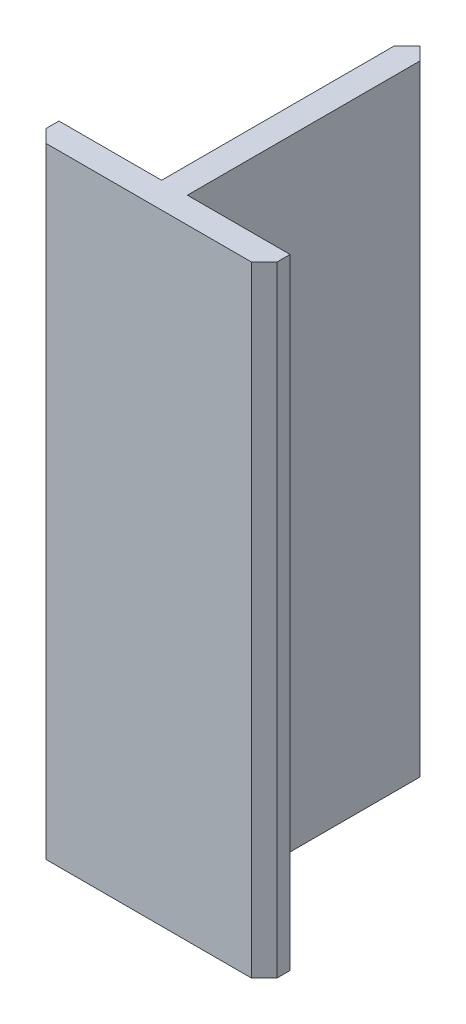
from build123d import *

# Parameters (mm, degrees)
SKETCH2_W             = 22.718450652
SKETCH2_H             = 2.54
EXTRUDE_THIN1_DEPTH   = 30.48
SKETCH2_W_2           = 2.54
SKETCH2_H_2           = 25.4
EXTRUDE_THIN1_2_DEPTH = 30.48
CHAMFER1_SIZE         = 1.27


with BuildPart() as part:
    # Sketch2 → Extrude-Thin1 (new, symmetric)
    with BuildSketch(Plane(origin=(0, 0, 0), x_dir=(1, 0, 0), z_dir=(0, 1, 0))):
        Rectangle(SKETCH2_W, SKETCH2_H)
    extrude(amount=EXTRUDE_THIN1_DEPTH, both=True)


with BuildPart() as body_2:
    # Sketch2 → Extrude-Thin1 2 (new, symmetric)
    with BuildSketch(Plane(origin=(0, 0, 0), x_dir=(1, 0, 0), z_dir=(0, 1, 0))):
        with Locations((0, 12.7)):
            Rectangle(SKETCH2_W_2, SKETCH2_H_2)
    extrude(amount=EXTRUDE_THIN1_2_DEPTH, both=True)

    # Combine1: union part
    add(part.part)

    # Chamfer1
    chamfer1_edges = [body_2.edges().sort_by_distance(p)[0] for p in [
        (-11.359225326, 0, 1.27),
        (11.359225326, 0, 1.27),
        (1.27, 0, -25.4),
        (-1.27, 0, -25.4),
    ]]
    chamfer(chamfer1_edges, length=CHAMFER1_SIZE - 0.0001)  # a hair under: the kernel refuses the full size


solid = body_2.part
